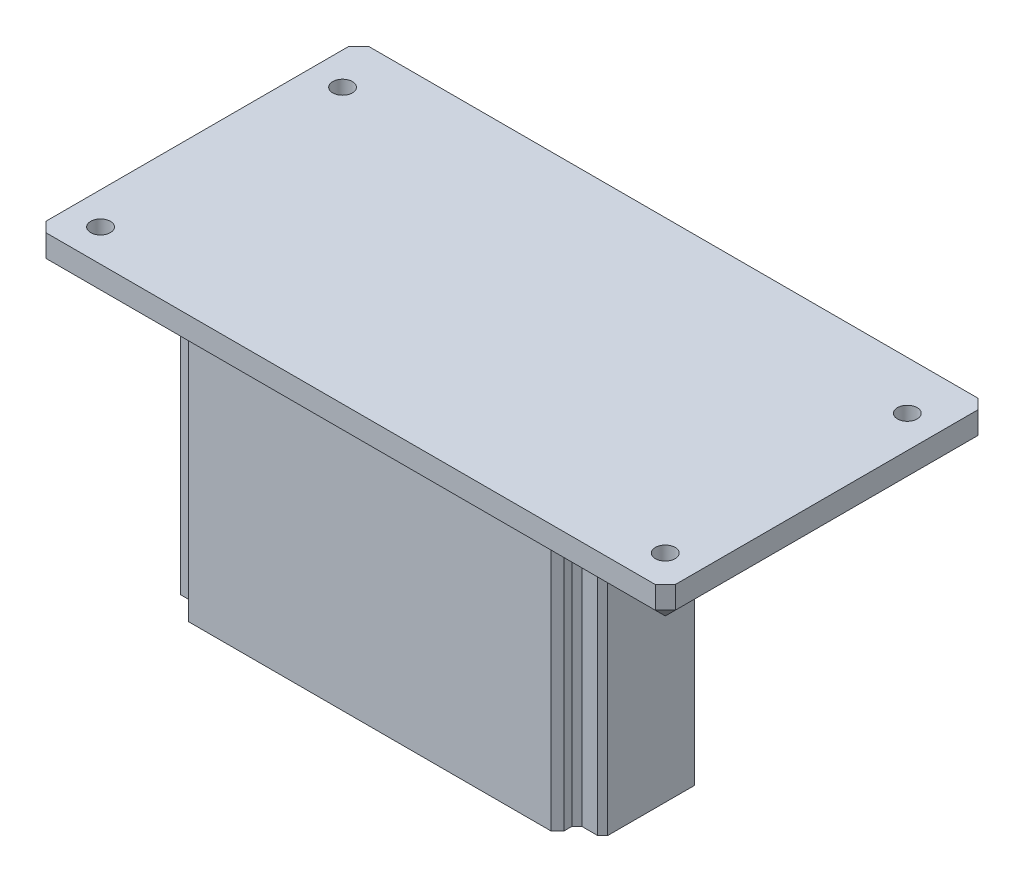
from build123d import *

# Parameters (mm, degrees)
SKETCH1_R                = 3.05
BOSS_EXTRUDE1_DEPTH      = 10
BOSS_EXTRUDE2_DEPTH      = 75.9
SKETCH3_R                = 1.4
CUT_EXTRUDE1_DEPTH       = 6
CHAMFER1_SIZE            = 1.55
CHAMFER2_SIZE            = 2
CHAMFER1_OF_MIRROR1_SIZE = 1.55
CHAMFER2_OF_MIRROR1_SIZE = 2
SKETCH4_W                = 135.019613606
SKETCH4_H                = 106.174514336
CUT_EXTRUDE2_DEPTH       = 236.5929965
SKETCH5_W                = 195
SKETCH5_H                = 0.5
CUT_EXTRUDE3_DEPTH       = 233.133711468
CHAMFER3_SIZE            = 3.1
CHAMFER4_SIZE            = 3.1


with BuildPart() as part:
    # Sketch1 → Boss-Extrude1 (new body)
    with BuildSketch(Plane(origin=(0, 0, 0), x_dir=(1, 0, 0), z_dir=(0, 1, 0))):
        Polygon((0, 0), (195, 0), (195, 95), (195, 100.5), (0, 100.5), (0, 95), align=None)
        with Locations((10, 85)):
            Circle(SKETCH1_R, mode=Mode.SUBTRACT)
        with Locations((185, 85)):
            Circle(SKETCH1_R, mode=Mode.SUBTRACT)
        with Locations((185, 10)):
            Circle(SKETCH1_R, mode=Mode.SUBTRACT)
        with Locations((10, 10)):
            Circle(SKETCH1_R, mode=Mode.SUBTRACT)
    boss_extrude1 = extrude(amount=BOSS_EXTRUDE1_DEPTH)

    # Sketch2 → Boss-Extrude2 (add)
    with BuildSketch(Plane(origin=(0, 10, 0), x_dir=(1, 0, 0), z_dir=(0, 1, 0))):
        with BuildLine():
            Line((43.7, 59), (91.1, 59))
            Line((91.1, 59), (91.1, 45.6))
            Line((91.1, 45.6), (158, 45.6))
            Line((158, 45.6), (158, 39.6))
            Line((158, 39.6), (166, 39.6))
            Line((166, 39.6), (166, 9.6))
            Line((166, 9.6), (158, 9.6))
            Line((158, 9.6), (158, 3.6))
            Line((158, 3.6), (41.7, 3.6))
            Line((41.7, 3.6), (41.7, 9.6))
            Line((41.7, 9.6), (33.7, 9.6))
            Line((33.7, 9.6), (33.7, 39.6))
            Line((33.7, 39.6), (41.7, 39.6))
            Line((41.7, 39.6), (41.7, 57))
            ThreePointArc((41.7, 57), (42.285786438, 58.414213562), (43.7, 59))
        make_face()
    boss_extrude2 = extrude(amount=BOSS_EXTRUDE2_DEPTH)

    # Sketch3 → Cut-Extrude1 (cut)
    with BuildSketch(Plane(origin=(0, 85.9, 0), x_dir=(1, 0, 0), z_dir=(0, 1, 0))):
        with Locations((37.7, 32.1)):
            Circle(SKETCH3_R)
        with Locations((37.7, 17.1)):
            Circle(SKETCH3_R)
        with Locations((162, 17.1)):
            Circle(SKETCH3_R)
        with Locations((162, 32.1)):
            Circle(SKETCH3_R)
    cut_extrude1 = extrude(amount=-CUT_EXTRUDE1_DEPTH, mode=Mode.SUBTRACT)

    # Chamfer1
    chamfer1_edges = [part.edges().sort_by_distance(p)[0] for p in [
        (41.7, 47.95, -9.6),
        (33.7, 47.95, -9.6),
        (33.7, 47.95, -39.6),
        (41.7, 47.95, -39.6),
        (166, 47.95, -9.6),
        (158, 47.95, -9.6),
        (158, 47.95, -39.6),
        (166, 47.95, -39.6),
    ]]
    chamfer(chamfer1_edges, length=CHAMFER1_SIZE)

    # Chamfer2
    chamfer2_edges = [part.edges().sort_by_distance(p)[0] for p in [
        (41.7, 47.95, -3.6),
        (158, 47.95, -45.6),
        (158, 47.95, -3.6),
    ]]
    chamfer(chamfer2_edges, length=CHAMFER2_SIZE)

    # Mirror1: Boss-Extrude1, Boss-Extrude2, Cut-Extrude1 across plane
    add(boss_extrude1.mirror(Plane(origin=(0, 0, 0), x_dir=(0, 0, 1), z_dir=(0, -1, 0))))
    add(boss_extrude2.mirror(Plane(origin=(0, 0, 0), x_dir=(0, 0, 1), z_dir=(0, -1, 0))))
    add(cut_extrude1.mirror(Plane(origin=(0, 0, 0), x_dir=(0, 0, 1), z_dir=(0, -1, 0))), mode=Mode.SUBTRACT)

    # Chamfer1 of Mirror1
    chamfer1_of_mirror1_edges = [part.edges().sort_by_distance(p)[0] for p in [
        (41.7, -47.95, -9.6),
        (33.7, -47.95, -9.6),
        (33.7, -47.95, -39.6),
        (41.7, -47.95, -39.6),
        (166, -47.95, -9.6),
        (158, -47.95, -9.6),
        (158, -47.95, -39.6),
        (166, -47.95, -39.6),
    ]]
    chamfer(chamfer1_of_mirror1_edges, length=CHAMFER1_OF_MIRROR1_SIZE)

    # Chamfer2 of Mirror1
    chamfer2_of_mirror1_edges = [part.edges().sort_by_distance(p)[0] for p in [
        (41.7, -47.95, -3.6),
        (158, -47.95, -45.6),
        (158, -47.95, -3.6),
    ]]
    chamfer(chamfer2_of_mirror1_edges, length=CHAMFER2_OF_MIRROR1_SIZE)

    # Sketch4 → Cut-Extrude2 (cut, through all)
    with BuildSketch(Plane.ZY):
        with Locations((-58.433006885, 53.087257168)):
            Rectangle(SKETCH4_W, SKETCH4_H)
    extrude(amount=-CUT_EXTRUDE2_DEPTH, mode=Mode.SUBTRACT)

    # Sketch5 → Cut-Extrude3 (cut, through all)
    with BuildSketch(Plane.XZ.offset(10)):
        with Locations((97.5, -100.25)):
            Rectangle(SKETCH5_W, SKETCH5_H)
    extrude(amount=-CUT_EXTRUDE3_DEPTH, mode=Mode.SUBTRACT)

    # Chamfer3
    chamfer3_edges = [part.edges().sort_by_distance(p)[0] for p in [
        (181.95, -10, -10),
        (181.95, -10, -85),
        (6.95, -10, -85),
        (6.95, -10, -10),
    ]]
    chamfer(chamfer3_edges, length=CHAMFER3_SIZE)

    # Chamfer4
    chamfer4_edges = [part.edges().sort_by_distance(p)[0] for p in [
        (0, -5, 0),
        (0, -5, -100),
        (195, -5, 0),
        (195, -5, -100),
        (195, -10, -50),
        (97.5, -10, 0),
        (97.5, -10, -100),
        (0, -10, -50),
    ]]
    chamfer(chamfer4_edges, length=CHAMFER4_SIZE)


solid = part.part
